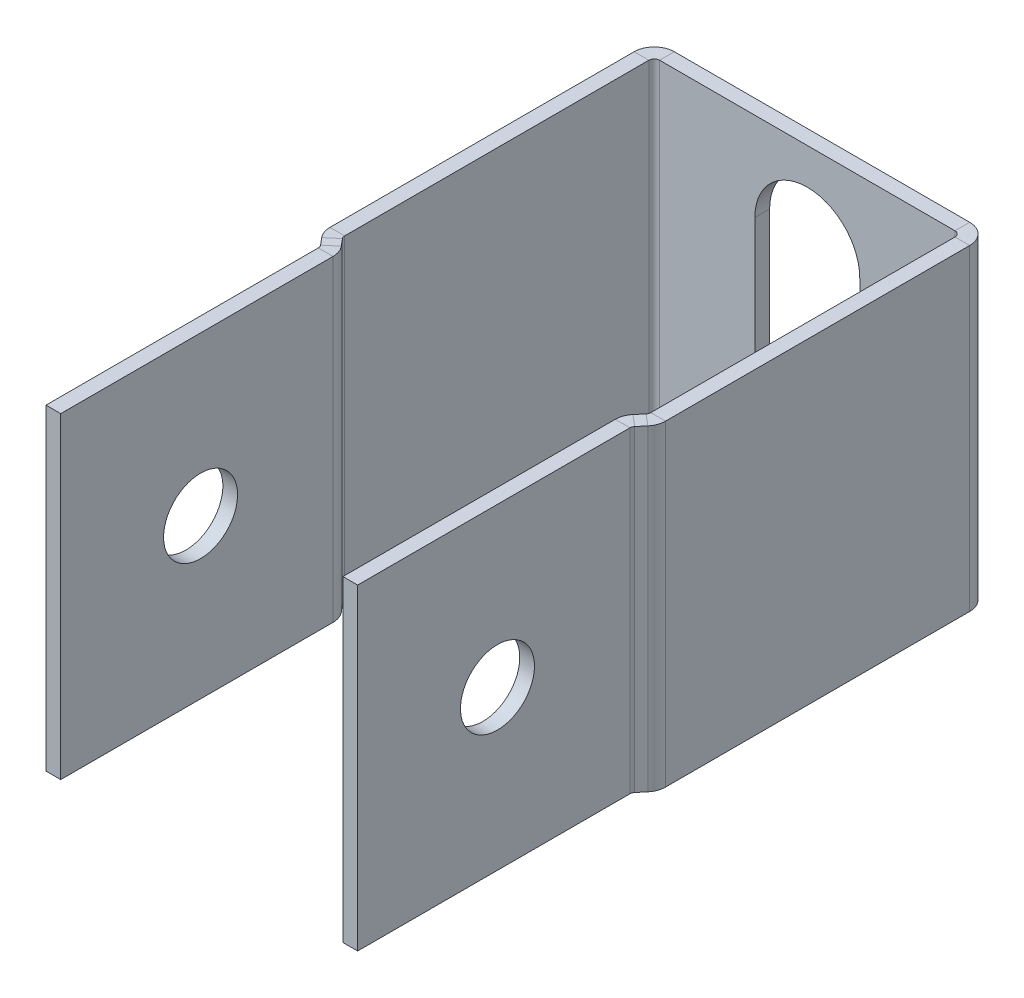
from build123d import *

# Parameters (mm, degrees)
SKETCH1_W                      = 45.72
SKETCH1_H                      = 43.18
BASE_FLANGE1_DEPTH             = 2.0066
EDGE_FLANGE1_STRIP_W           = 9.4996
EDGE_FLANGE1_STRIP_H           = 2.0066
EDGE_FLANGE1_STRIP_CUT_DEPTH   = 43.18
EDGE_FLANGE1_STRIP_2_W         = 9.4996
EDGE_FLANGE1_STRIP_2_H         = 2.0066
EDGE_FLANGE1_STRIP_CUT_2_DEPTH = 43.18
EDGE_FLANGE1_DEPTH             = 43.18
EDGE_FLANGE1_BEND_DEPTH        = 43.18
EDGE_FLANGE2_STRIP_CUT_DEPTH   = 43.18
EDGE_FLANGE2_STRIP_CUT_2_DEPTH = 43.18
EDGE_FLANGE2_DEPTH             = 43.18
EDGE_FLANGE2_BEND_DEPTH        = 43.18
EDGE_FLANGE4_STRIP_CUT_DEPTH   = 43.18
EDGE_FLANGE4_STRIP_CUT_2_DEPTH = 43.18
EDGE_FLANGE4_DEPTH             = 43.18
EDGE_FLANGE4_BEND_DEPTH        = 43.18
F_3_8_CLEARANCE_HOLE3_D        = 10.0838
F_3_8_CLEARANCE_HOLE3_DEPTH    = 25.4
F_3_8_CLEARANCE_HOLE3_TIP      = 3.029479155
F_3_8_CLEARANCE_HOLE4_D        = 10.0838
F_3_8_CLEARANCE_HOLE4_DEPTH    = 25.4
F_3_8_CLEARANCE_HOLE4_TIP      = 3.029479155
CUT_EXTRUDE1_REACH             = 92.157


# Sheet-metal steps are written as plain solids
with BuildPart() as part:
    # Sketch1 → Base-Flange1 (new body)
    with BuildSketch(Plane.XY):
        Rectangle(SKETCH1_W, SKETCH1_H)
    extrude(amount=-BASE_FLANGE1_DEPTH)

    # Edge-Flange1 strip (across the edge) → Edge-Flange1 strip cut (cut)
    with BuildSketch(Plane(origin=(22.86, -21.59, 0), x_dir=(-1, 0, 0), z_dir=(0, 1, 0))):
        with Locations((-2.0066, -1.0033)):
            Rectangle(EDGE_FLANGE1_STRIP_W, EDGE_FLANGE1_STRIP_H)
    extrude(amount=EDGE_FLANGE1_STRIP_CUT_DEPTH, mode=Mode.SUBTRACT)

    # Edge-Flange1 strip 2 (across the edge) → Edge-Flange1 strip cut 2 (cut)
    with BuildSketch(Plane(origin=(-22.86, 21.59, 0), x_dir=(1, 0, 0), z_dir=(0, -1, 0))):
        with Locations((-2.0066, -1.0033)):
            Rectangle(EDGE_FLANGE1_STRIP_2_W, EDGE_FLANGE1_STRIP_2_H)
    extrude(amount=EDGE_FLANGE1_STRIP_CUT_2_DEPTH, mode=Mode.SUBTRACT)

    # Edge-Flange1 section (across the edge) → Edge-Flange1 (add)
    with BuildSketch(Plane(origin=(22.86, -21.59, 0), x_dir=(-1, 0, 0), z_dir=(0, 1, 0))):
        with BuildLine():
            Line((0, 0.7366), (0, 42.4434))
            Line((0, 42.4434), (2.0066, 42.4434))
            Line((2.0066, 42.4434), (2.0066, 0.7366))
            ThreePointArc((2.0066, 0.7366), (2.222345145, 0.215745145), (2.7432, 0))
            Line((2.7432, 0), (2.7432, -2.0066))
            ThreePointArc((2.7432, -2.0066), (0.803464678, -1.203135322), (0, 0.7366))
        make_face()
    extrude(amount=EDGE_FLANGE1_DEPTH)

    # Edge-Flange1 section 2 (across the edge) → Edge-Flange1 bend (add)
    with BuildSketch(Plane(origin=(-22.86, 21.59, 0), x_dir=(1, 0, 0), z_dir=(0, -1, 0))):
        with BuildLine():
            Line((0, 0.7366), (0, 42.4434))
            Line((0, 42.4434), (2.0066, 42.4434))
            Line((2.0066, 42.4434), (2.0066, 0.7366))
            ThreePointArc((2.0066, 0.7366), (2.222345145, 0.215745145), (2.7432, 0))
            Line((2.7432, 0), (2.7432, -2.0066))
            ThreePointArc((2.7432, -2.0066), (0.803464678, -1.203135322), (0, 0.7366))
        make_face()
    extrude(amount=EDGE_FLANGE1_BEND_DEPTH)

    # Edge-Flange2 strip (across the edge) → Edge-Flange2 strip cut (cut)
    with BuildSketch(Plane(origin=(20.8534, -21.59, 42.4434), x_dir=(-0.7660444431189839, 0, -0.6427876096865324), z_dir=(0, 1, 0))):
        Polygon((-7.471038293, 5.781921296), (-1.364813116, -1.495194496), (0.172331663, -0.205376879), (-5.933893514, 7.071738913), align=None)
    extrude(amount=EDGE_FLANGE2_STRIP_CUT_DEPTH, mode=Mode.SUBTRACT)

    # Edge-Flange2 strip 2 (across the edge) → Edge-Flange2 strip cut 2 (cut)
    with BuildSketch(Plane(origin=(-20.8534, 21.59, 42.4434), x_dir=(0.7660444431189839, 0, -0.6427876096865324), z_dir=(0, -1, 0))):
        Polygon((-7.471038293, 5.781921296), (-1.364813116, -1.495194496), (0.172331663, -0.205376879), (-5.933893514, 7.071738913), align=None)
    extrude(amount=EDGE_FLANGE2_STRIP_CUT_2_DEPTH, mode=Mode.SUBTRACT)

    # Edge-Flange2 section (across the edge) → Edge-Flange2 (add)
    with BuildSketch(Plane(origin=(20.8534, -21.59, 42.4434), x_dir=(-0.7660444431189839, 0, -0.6427876096865324), z_dir=(0, 1, 0))):
        with BuildLine():
            Line((-2.0066, 0.268100475), (-2.0066, 1.809657328))
            Line((-2.0066, 1.809657328), (0, 1.809657328))
            Line((0, 1.809657328), (0, 0.268100475))
            ThreePointArc((0, 0.268100475), (0.044422416, 0.016168437), (0.172331663, -0.205376879))
            Line((0.172331663, -0.205376879), (-1.364813116, -1.495194496))
            ThreePointArc((-1.364813116, -1.495194496), (-1.841164797, -0.670129183), (-2.0066, 0.268100475))
        make_face()
    extrude(amount=EDGE_FLANGE2_DEPTH)

    # Edge-Flange2 section 2 (across the edge) → Edge-Flange2 bend (add)
    with BuildSketch(Plane(origin=(-20.8534, 21.59, 42.4434), x_dir=(0.7660444431189839, 0, -0.6427876096865324), z_dir=(0, -1, 0))):
        with BuildLine():
            Line((-2.0066, 0.268100475), (-2.0066, 1.809657328))
            Line((-2.0066, 1.809657328), (0, 1.809657328))
            Line((0, 1.809657328), (0, 0.268100475))
            ThreePointArc((0, 0.268100475), (0.044422416, 0.016168437), (0.172331663, -0.205376879))
            Line((0.172331663, -0.205376879), (-1.364813116, -1.495194496))
            ThreePointArc((-1.364813116, -1.495194496), (-1.841164797, -0.670129183), (-2.0066, 0.268100475))
        make_face()
    extrude(amount=EDGE_FLANGE2_BEND_DEPTH)

    # Edge-Flange4 strip (across the edge) → Edge-Flange4 strip cut (cut)
    with BuildSketch(Plane(origin=(-21.227319471, -21.59, 45.119495558), x_dir=(-1, 0, 0), z_dir=(0, 1, 0))):
        Polygon((-7.471038293, 5.781921296), (-1.364813116, -1.495194496), (0.172331663, -0.205376879), (-5.933893514, 7.071738913), align=None)
    extrude(amount=EDGE_FLANGE4_STRIP_CUT_DEPTH, mode=Mode.SUBTRACT)

    # Edge-Flange4 strip 2 (across the edge) → Edge-Flange4 strip cut 2 (cut)
    with BuildSketch(Plane(origin=(21.227319471, 21.59, 45.119495558), x_dir=(1, 0, 0), z_dir=(0, -1, 0))):
        Polygon((-7.471038293, 5.781921296), (-1.364813116, -1.495194496), (0.172331663, -0.205376879), (-5.933893514, 7.071738913), align=None)
    extrude(amount=EDGE_FLANGE4_STRIP_CUT_2_DEPTH, mode=Mode.SUBTRACT)

    # Edge-Flange4 section (across the edge) → Edge-Flange4 (add)
    with BuildSketch(Plane(origin=(-21.227319471, -21.59, 45.119495558), x_dir=(-1, 0, 0), z_dir=(0, 1, 0))):
        with BuildLine():
            Line((-2.0066, 0.268100475), (-2.0066, 37.369657328))
            Line((-2.0066, 37.369657328), (0, 37.369657328))
            Line((0, 37.369657328), (0, 0.268100475))
            ThreePointArc((0, 0.268100475), (0.044422416, 0.016168437), (0.172331663, -0.205376879))
            Line((0.172331663, -0.205376879), (-1.364813116, -1.495194496))
            ThreePointArc((-1.364813116, -1.495194496), (-1.841164797, -0.670129183), (-2.0066, 0.268100475))
        make_face()
    extrude(amount=EDGE_FLANGE4_DEPTH)

    # Edge-Flange4 section 2 (across the edge) → Edge-Flange4 bend (add)
    with BuildSketch(Plane(origin=(21.227319471, 21.59, 45.119495558), x_dir=(1, 0, 0), z_dir=(0, -1, 0))):
        with BuildLine():
            Line((-2.0066, 0.268100475), (-2.0066, 37.369657328))
            Line((-2.0066, 37.369657328), (0, 37.369657328))
            Line((0, 37.369657328), (0, 0.268100475))
            ThreePointArc((0, 0.268100475), (0.044422416, 0.016168437), (0.172331663, -0.205376879))
            Line((0.172331663, -0.205376879), (-1.364813116, -1.495194496))
            ThreePointArc((-1.364813116, -1.495194496), (-1.841164797, -0.670129183), (-2.0066, 0.268100475))
        make_face()
    extrude(amount=EDGE_FLANGE4_BEND_DEPTH)

    # 3/8 Clearance Hole3
    with Locations(Plane.ZY.offset(21.227319471)):
        with Locations((63.439152886, 0)):
            Hole(F_3_8_CLEARANCE_HOLE3_D / 2, depth=F_3_8_CLEARANCE_HOLE3_DEPTH)
            with Locations((0, 0, -(F_3_8_CLEARANCE_HOLE3_DEPTH + F_3_8_CLEARANCE_HOLE3_TIP / 2))):  # 118° drill point
                Cone(0, F_3_8_CLEARANCE_HOLE3_D / 2, F_3_8_CLEARANCE_HOLE3_TIP, mode=Mode.SUBTRACT)

    # 3/8 Clearance Hole4
    with Locations(Plane(origin=(21.227319471, 0, 0), x_dir=(0, 0, -1), z_dir=(1, 0, 0))):
        with Locations((-63.439152886, 0)):
            Hole(F_3_8_CLEARANCE_HOLE4_D / 2, depth=F_3_8_CLEARANCE_HOLE4_DEPTH)
            with Locations((0, 0, -(F_3_8_CLEARANCE_HOLE4_DEPTH + F_3_8_CLEARANCE_HOLE4_TIP / 2))):  # 118° drill point
                Cone(0, F_3_8_CLEARANCE_HOLE4_D / 2, F_3_8_CLEARANCE_HOLE4_TIP, mode=Mode.SUBTRACT)

    # Sketch38 → Cut-Extrude1 (cut, up to next)
    with BuildSketch(Plane(origin=(0, 0, -2.0066), x_dir=(-1, 0, 0), z_dir=(0, 0, -1)), mode=Mode.PRIVATE) as cut_extrude1_sk1:
        with BuildLine():
            Line((-7.14375, -9.525), (-7.14375, 9.525))
            ThreePointArc((-7.14375, 9.525), (0, 16.66875), (7.14375, 9.525))
            Line((7.14375, 9.525), (7.14375, -9.525))
            ThreePointArc((7.14375, -9.525), (0, -16.66875), (-7.14375, -9.525))
        make_face()
    cut_extrude1_tool1 = extrude(cut_extrude1_sk1.sketch, amount=-CUT_EXTRUDE1_REACH, mode=Mode.PRIVATE) & part.part
    add(cut_extrude1_tool1.solids().sort_by_distance((0, 0, -2.0066))[0], mode=Mode.SUBTRACT)


solid = part.part
